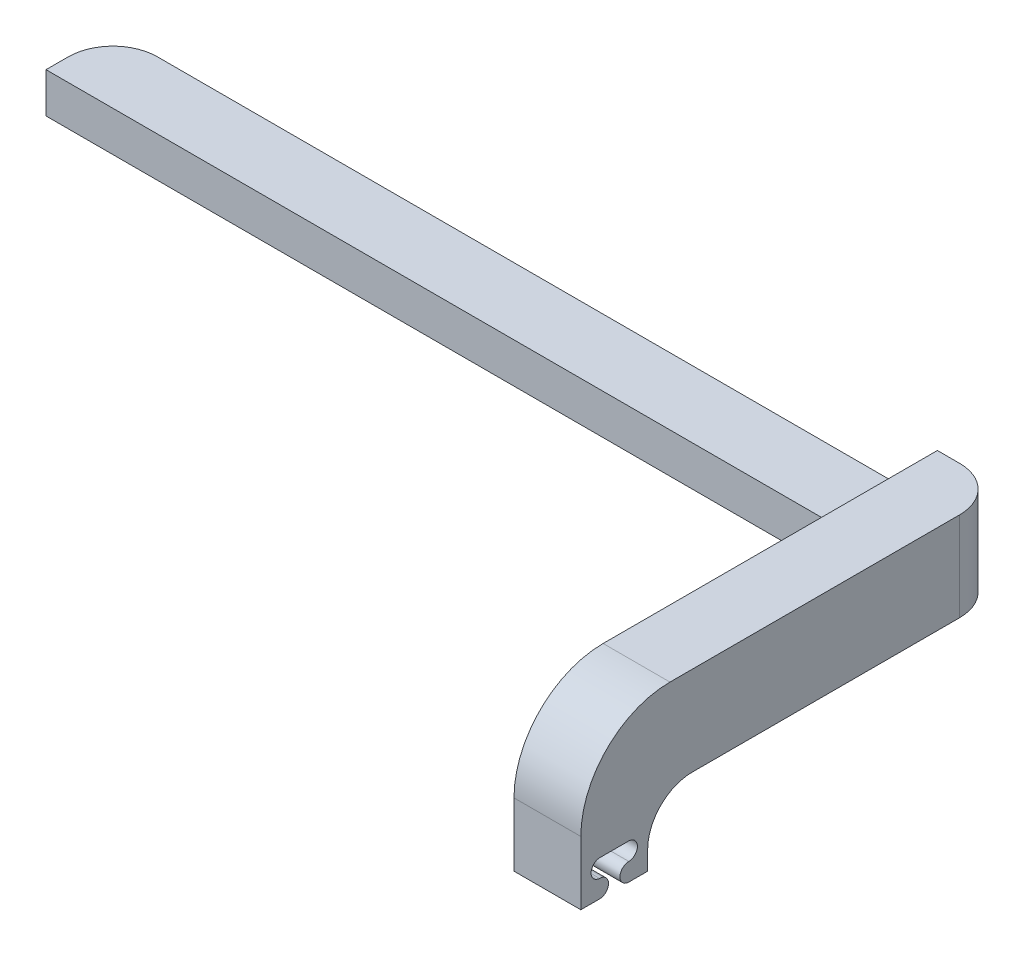
from build123d import *

# Parameters (mm, degrees)
PUSHER_BASE_DEPTH   = 15
SKETCH3_R           = 1.95
SCREW_HOLE_DEPTH    = 7.5
SKETCH6_W           = 7.5
SKETCH6_H           = 30.25
PUSHER_HEAD_DEPTH   = 3.75
FILLET1_R           = 2
SKETCH9_W           = 40
SKETCH9_H           = 10
BOSS_EXTRUDE1_DEPTH = 7.5
SKETCH10_W          = 92.5
SKETCH10_H          = 4.5
BOSS_EXTRUDE2_DEPTH = 7.5
FILLET7_R           = 10
FILLET8_R           = 5
FILLET9_START       = 44.416899441
FILLET9_DEPTH       = 7.5
CUT_EXTRUDE1_DEPTH  = 10
SKETCH13_W          = 31.257668492
SKETCH13_H          = 16.460534108
CUT_EXTRUDE2_DEPTH  = 40


with BuildPart() as part:
    # Sketch1 → pusher base (new body)
    with BuildSketch(Plane.XY):
        Polygon((59.166899441, -45.877477752), (51.666899441, -45.877477752), (44.666899441, -45.877477752), (37.166899441, -45.877477752), (37.166899441, -69.377477752), (41.916899441, -69.377477752), (41.916899441, -64.127477752), (54.416899441, -64.127477752), (54.416899441, -69.377477752), (59.166899441, -69.377477752), align=None)
        with BuildLine():
            Line((48.279417247, -51.877477752), (48.054381634, -51.877477752))
            ThreePointArc((48.054381634, -51.877477752), (39.166899441, -50.877477752), (48.054381634, -49.877477752))
            Line((48.054381634, -49.877477752), (48.279417247, -49.877477752))
            ThreePointArc((48.279417247, -49.877477752), (57.166899441, -50.877477752), (48.279417247, -51.877477752))
        make_face(mode=Mode.SUBTRACT)
    extrude(amount=PUSHER_BASE_DEPTH)

    # Sketch3 → screw hole (cut)
    with BuildSketch(Plane.XZ.offset(64.127477752)):
        with Locations(Location((48.166899441, 7.5, 0), (0, 0, 270))):
            Circle(SKETCH3_R)
    extrude(amount=-SCREW_HOLE_DEPTH, mode=Mode.SUBTRACT)

    # Sketch6 → pusher head (add, symmetric)
    with BuildSketch(Plane.XY.offset(7.5)):
        with Locations((48.166899441, -30.752477752)):
            Rectangle(SKETCH6_W, SKETCH6_H)
    extrude(amount=PUSHER_HEAD_DEPTH, both=True)

    # Fillet1
    # the kernel refuses this fillet: 2 mm, written as the material it takes off along each edge
    with BuildSketch(Plane(origin=(64.166899441, -45.877477752, 0), x_dir=(0, -1, 0), z_dir=(-1, 0, 0)), Plane(origin=(32.166899441, -45.877477752, 15), x_dir=(0, -1, 0), z_dir=(1, 0, 0))) as fillet1_piece_1:
        with BuildLine():
            CenterArc((FILLET1_R, FILLET1_R), FILLET1_R, 180, 90)
            Line((0, FILLET1_R), (0, 0))
            Line((0, 0), (FILLET1_R, 0))
        make_face()
    extrude(amount=32, mode=Mode.SUBTRACT)

    # Sketch9 → Boss-Extrude1 (add)
    with BuildSketch(Plane(origin=(51.916899441, 0, 0), x_dir=(0, 0, -1), z_dir=(1, 0, 0))):
        with Locations((16.25, -20.627477752)):
            Rectangle(SKETCH9_W, SKETCH9_H)
    extrude(amount=-BOSS_EXTRUDE1_DEPTH)

    # Sketch10 → Boss-Extrude2 (add)
    with BuildSketch(Plane(origin=(0, 0, -36.25), x_dir=(-1, 0, 0), z_dir=(0, 0, -1))):
        with Locations((1.833100559, -23.377477752)):
            Rectangle(SKETCH10_W, SKETCH10_H)
    extrude(amount=-BOSS_EXTRUDE2_DEPTH)

    # Fillet7
    fillet7_edges = [part.edges().sort_by_distance(p)[0] for p in [
        (48.166899441, -15.627477752, 11.25),
    ]]
    fillet(fillet7_edges, radius=FILLET7_R)

    # Fillet8
    fillet8_edges = [part.edges().sort_by_distance(p)[0] for p in [
        (-48.083100559, -23.377477752, -36.25),
        (48.166899441, -25.627477752, 3.75),
        (51.916899441, -20.627477752, -36.25),
    ]]
    fillet(fillet8_edges, radius=FILLET8_R)

    # Fillet9: read off the stored shape, not the designer's step
    # Fillet9 outline → Fillet9 (add)
    with BuildSketch(Plane.YZ.offset(FILLET9_START)):
        with BuildLine():
            ThreePointArc((-45.877477752, 2), (-45.935475959, 1.521848316), (-46.106106786, 1.071428571))
            ThreePointArc((-46.106106786, 1.071428571), (-44.265425216, 3.02826734), (-41.677679368, 3.75))
            Line((-41.677679368, 3.75), (-45.877477752, 3.75))
            Line((-45.877477752, 3.75), (-45.877477752, 2))
        make_face()
        with BuildLine():
            Line((-45.877477752, 13), (-45.877477752, 11.25))
            Line((-45.877477752, 11.25), (-41.677679368, 11.25))
            ThreePointArc((-41.677679368, 11.25), (-44.265425216, 11.97173266), (-46.106106785, 13.928571429))
            ThreePointArc((-46.106106785, 13.928571429), (-45.935475959, 13.478151684), (-45.877477752, 13))
        make_face()
    extrude(amount=FILLET9_DEPTH)

    # Sketch12 → Cut-Extrude1 (cut)
    with BuildSketch(Plane.ZY.offset(-44.416899441)):
        with BuildLine():
            ThreePointArc((5.858454214, -30.752477752), (6.858454214, -31.752477752), (5.858454214, -32.752477752))
            Line((5.858454214, -32.752477752), (3.75, -32.752477752))
            Line((3.75, -32.752477752), (3.75, -45.877477752))
            Line((3.75, -45.877477752), (11.25, -45.877477752))
            Line((11.25, -45.877477752), (11.25, -32.752477752))
            Line((11.25, -32.752477752), (9.141545786, -32.752477752))
            ThreePointArc((9.141545786, -32.752477752), (8.141545786, -31.752477752), (9.141545786, -30.752477752))
            ThreePointArc((9.141545786, -30.752477752), (10.09823306, -29.752477752), (9.141545786, -28.752477752))
            Line((9.141545786, -28.752477752), (5.858454214, -28.752477752))
            ThreePointArc((5.858454214, -28.752477752), (4.90176694, -29.752477752), (5.858454214, -30.752477752))
        make_face()
    extrude(amount=-CUT_EXTRUDE1_DEPTH, mode=Mode.SUBTRACT)


with BuildPart() as cut_extrude1_piece_1:
    # of the separate pieces the step leaves, piece 1, a body of its own (cut_extrude1_pieces)
    add(part.part.solids().sort_by_distance((44.416899441, -30.627477752, 3.75))[0])


with BuildPart() as cut_extrude1_piece_2:
    # of the separate pieces the step leaves, piece 2, a body of its own (cut_extrude1_pieces)
    add(part.part.solids().sort_by_distance((44.416899441, -45.877477752, 11.25))[0])

    # Sketch13 → Cut-Extrude2 (cut)
    with BuildSketch(Plane.XZ.offset(32.752477752)):
        with Locations((47.849248082, 8.230267054)):
            Rectangle(SKETCH13_W, SKETCH13_H)
    extrude(amount=CUT_EXTRUDE2_DEPTH, mode=Mode.SUBTRACT)


solid = cut_extrude1_piece_1.part
